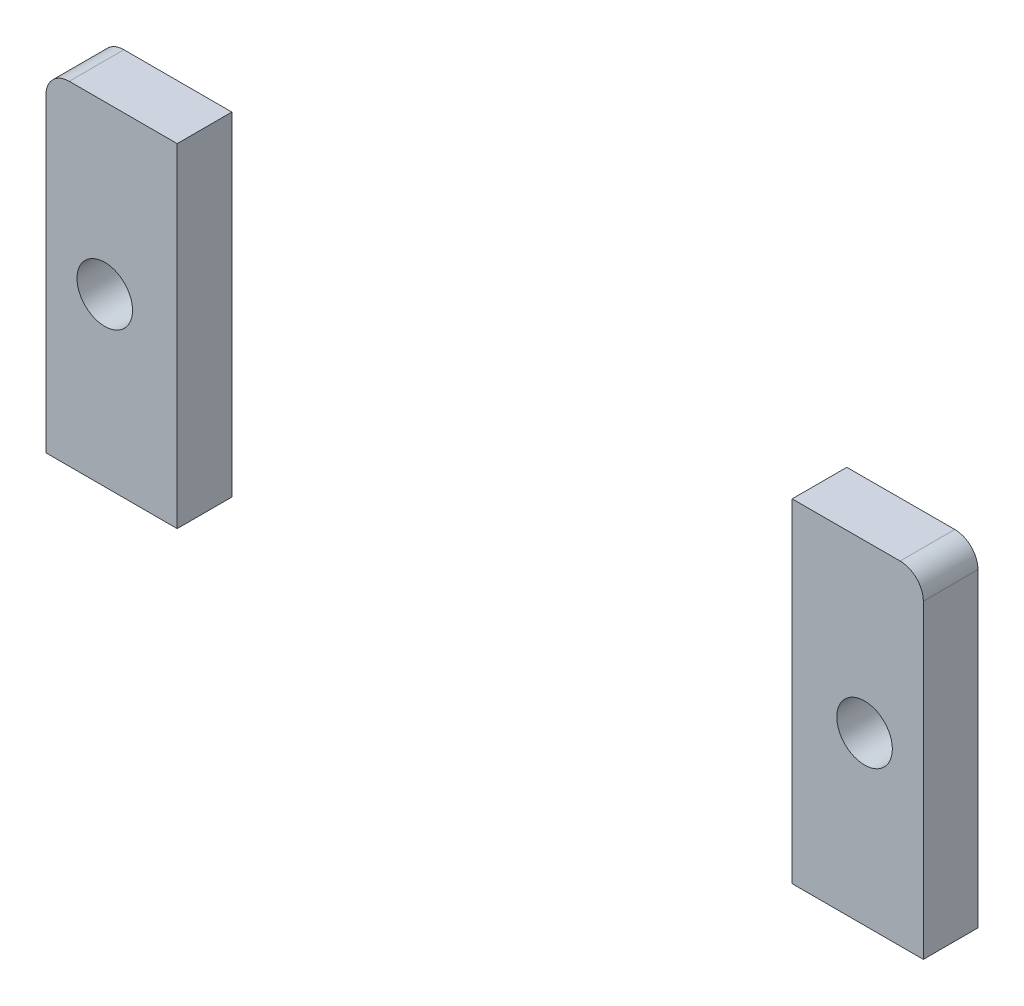
from build123d import *

# Parameters (mm, degrees)
SKETCH1_R             = 1.016
BOSS_EXTRUDE1_DEPTH   = 2
BOSS_EXTRUDE1_2_DEPTH = 2


with BuildPart() as part:
    # Sketch1 → Boss-Extrude1 (new body)
    with BuildSketch(Plane.XY):
        with BuildLine():
            Line((11.25, 6.094097151), (11.25, -6.1))
            Line((11.25, -6.1), (16.05, -6.1))
            Line((16.05, -6.1), (16.05, 5.25))
            ThreePointArc((16.05, 5.25), (15.801040764, 5.851040764), (15.2, 6.1))
            Line((15.2, 6.1), (11.25, 6.094097151))
        make_face()
        with Locations((13.9, 0)):
            Circle(SKETCH1_R, mode=Mode.SUBTRACT)
    extrude(amount=BOSS_EXTRUDE1_DEPTH)


with BuildPart() as body_2:
    # Sketch1 → Boss-Extrude1 2 (new body)
    with BuildSketch(Plane.XY):
        with BuildLine():
            Line((-11.25, -6.1), (-11.25, 6.1))
            Line((-11.25, 6.1), (-15.2, 6.1))
            ThreePointArc((-15.2, 6.1), (-15.801040764, 5.851040764), (-16.05, 5.25))
            Line((-16.05, 5.25), (-16.05, -6.1))
            Line((-16.05, -6.1), (-11.25, -6.1))
        make_face()
        with Locations((-13.9, 0)):
            Circle(SKETCH1_R, mode=Mode.SUBTRACT)
    extrude(amount=BOSS_EXTRUDE1_2_DEPTH)


solid = Compound([part.part, body_2.part])
